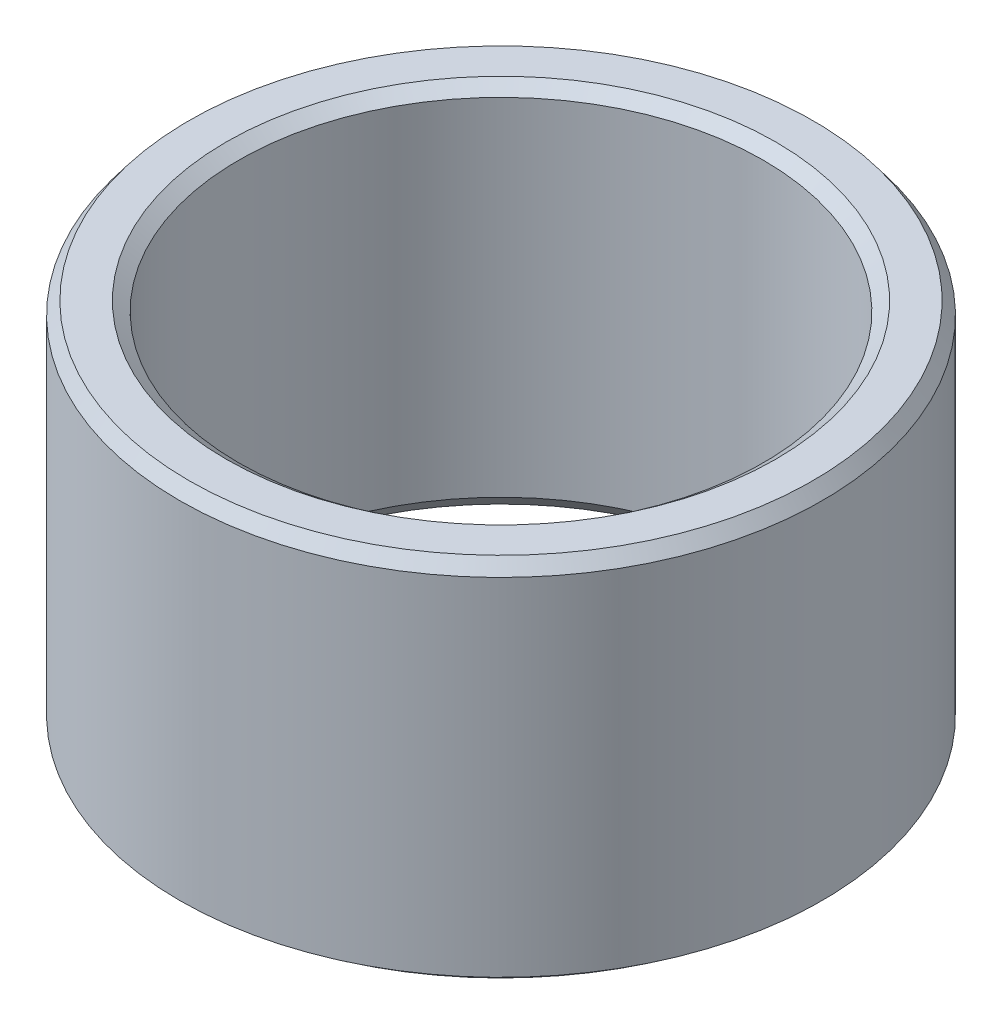
from build123d import *
from OCP.BRepFilletAPI import BRepFilletAPI_MakeChamfer

# Parameters (mm, degrees)
SKETCH1_R           = 55
BOSS_EXTRUDE1_DEPTH = 63.033447075
SKETCH2_R           = 44.883689323
CUT_EXTRUDE1_DEPTH  = 101.116009959
CHAMFER1_SIZE       = 2.148002666
CHAMFER1_SIZE2      = 1.612099981


with BuildPart() as part:
    # Sketch1 → Boss-Extrude1 (new body)
    with BuildSketch(Plane(origin=(0, 0, 0), x_dir=(1, 0, 0), z_dir=(0, 1, 0))):
        Circle(SKETCH1_R)
    extrude(amount=BOSS_EXTRUDE1_DEPTH)

    # Sketch2 → Cut-Extrude1 (cut, through all)
    with BuildSketch(Plane(origin=(0, 0, 0), x_dir=(1, 0, 0), z_dir=(0, 1, 0))):
        Circle(SKETCH2_R)
    extrude(amount=CUT_EXTRUDE1_DEPTH, mode=Mode.SUBTRACT)

    # Chamfer1: one chamfer whose edges measure the first distance from different faces: ONE call of the kernel's chamfer builder (chamfer() names one face for all edges)
    chamfer1_edges_1 = [part.edges().sort_by_distance(p)[0] for p in [
        (-44.883689323, 63.033447075, 0),
    ]]
    chamfer1_side_1 = [part.faces().sort_by_distance(p)[0] for p in [
        (-53.444365081, 63.033447075, 0),
    ]]
    chamfer1_edges_2 = [part.edges().sort_by_distance(p)[0] for p in [
        (-44.883689323, 0, 0),
    ]]
    chamfer1_side_2 = [part.faces().sort_by_distance(p)[0] for p in [
        (-44.883689323, 31.516723538, 0),
    ]]
    chamfer1_edges_3 = [part.edges().sort_by_distance(p)[0] for p in [
        (-55, 0, 0),
    ]]
    chamfer1_side_3 = [part.faces().sort_by_distance(p)[0] for p in [
        (-53.444365081, 0, 0),
    ]]
    chamfer1_edges_4 = [part.edges().sort_by_distance(p)[0] for p in [
        (-55, 63.033447075, 0),
    ]]
    chamfer1_side_4 = [part.faces().sort_by_distance(p)[0] for p in [
        (-55, 31.516723538, 0),
    ]]
    chamfer1 = BRepFilletAPI_MakeChamfer(part.part.solid().wrapped)
    for e in chamfer1_edges_1:
        chamfer1.Add(CHAMFER1_SIZE, CHAMFER1_SIZE2, e.wrapped, chamfer1_side_1[0].wrapped)  # the first distance lies on this face
    for e in chamfer1_edges_2:
        chamfer1.Add(CHAMFER1_SIZE, CHAMFER1_SIZE2, e.wrapped, chamfer1_side_2[0].wrapped)  # the first distance lies on this face
    for e in chamfer1_edges_3:
        chamfer1.Add(CHAMFER1_SIZE, CHAMFER1_SIZE2, e.wrapped, chamfer1_side_3[0].wrapped)  # the first distance lies on this face
    for e in chamfer1_edges_4:
        chamfer1.Add(CHAMFER1_SIZE, CHAMFER1_SIZE2, e.wrapped, chamfer1_side_4[0].wrapped)  # the first distance lies on this face
    add(Compound.cast(chamfer1.Shape()), mode=Mode.REPLACE)


solid = part.part
